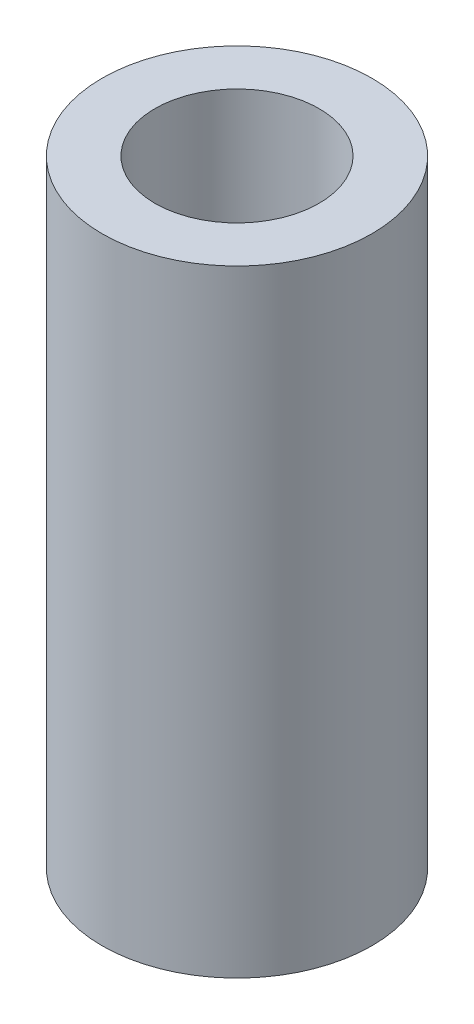
from build123d import *

# Parameters (mm, degrees)
SKETCH1_R           = 12.5
BOSS_EXTRUDE1_DEPTH = 57.176879478
SKETCH2_R           = 7.6112969
CUT_EXTRUDE1_DEPTH  = 60.847268499


with BuildPart() as part:
    # Sketch1 → Boss-Extrude1 (new body)
    with BuildSketch(Plane(origin=(0, 0, 0), x_dir=(1, 0, 0), z_dir=(0, 1, 0))):
        Circle(SKETCH1_R)
    extrude(amount=BOSS_EXTRUDE1_DEPTH)

    # Sketch2 → Cut-Extrude1 (cut, through all)
    with BuildSketch(Plane(origin=(0, 0, 0), x_dir=(1, 0, 0), z_dir=(0, 1, 0))):
        Circle(SKETCH2_R)
    extrude(amount=CUT_EXTRUDE1_DEPTH, mode=Mode.SUBTRACT)


solid = part.part
